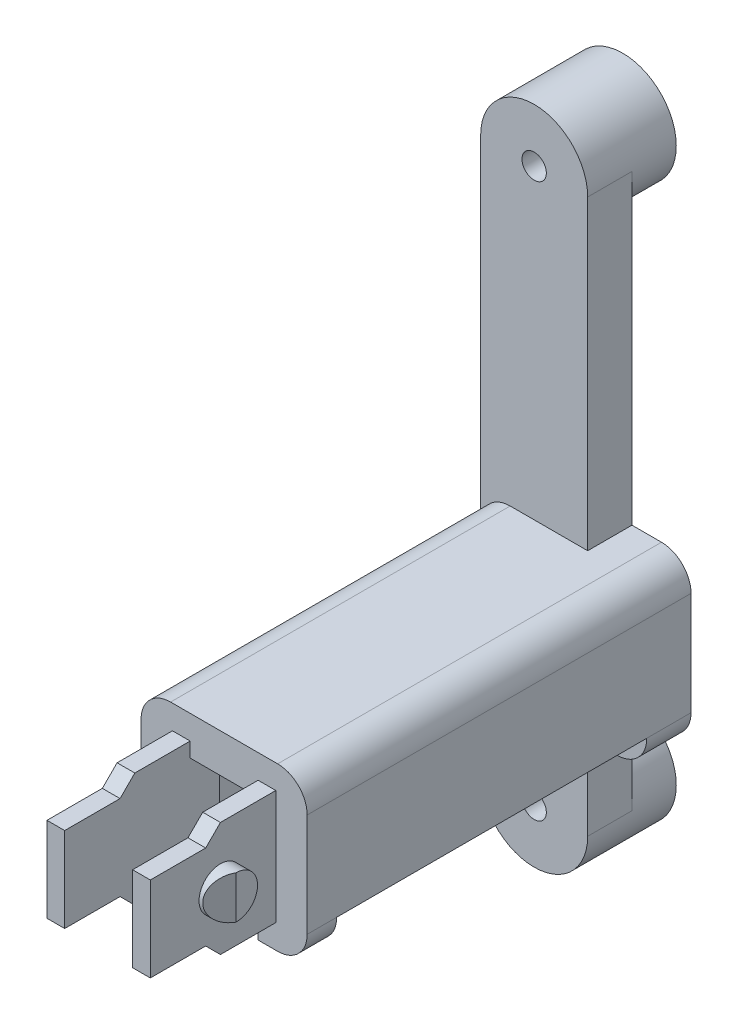
from build123d import *
from build123d.topology import SkipClean

# Parameters (mm, degrees)
SKETCH1_R           = 1.65
BOSS_EXTRUDE1_DEPTH = 75
SKETCH7_R           = 3
CUT_EXTRUDE6_DEPTH  = 6
CUT_EXTRUDE12_START = -63
CUT_EXTRUDE12_DEPTH = 63
SKETCH9_W           = 17
SKETCH9_H           = 22
SKETCH9_R           = 2.9
CUT_EXTRUDE8_DEPTH  = 4.25
CUT_EXTRUDE9_START  = -4.25
SKETCH10_W          = 17
SKETCH10_H          = 22
SKETCH10_R          = 2.9
CUT_EXTRUDE9_DEPTH  = 4.25
CUT_EXTRUDE10_DEPTH = 17
CUT_EXTRUDE11_START = -18.25
CUT_EXTRUDE11_DEPTH = 14
CUT_EXTRUDE13_START = -13.9000001
CUT_EXTRUDE13_DEPTH = 6.9000001
CUT_EXTRUDE14_DEPTH = 42


with BuildPart() as part:
    # Sketch1 → Boss-Extrude1 (new body)
    with BuildSketch(Plane.XY):
        with BuildLine():
            Line((15.25, 29.5), (15.25, 15.5))
            ThreePointArc((15.25, 15.5), (14.078427125, 12.671572875), (11.25, 11.5))
            Line((11.25, 11.5), (7.25, 11.5))
            Line((7.25, 11.5), (7.25, 0))
            ThreePointArc((7.25, 0), (0, -7.25), (-7.25, 0))
            Line((-7.25, 0), (-7.25, 75))
            ThreePointArc((-7.25, 75), (0, 82.25), (7.25, 75))
            Line((7.25, 75), (7.25, 33.5))
            Line((7.25, 33.5), (11.25, 33.5))
            ThreePointArc((11.25, 33.5), (14.078427125, 32.328427125), (15.25, 29.5))
        make_face()
        Circle(SKETCH1_R, mode=Mode.SUBTRACT)
        with Locations((0, 75)):
            Circle(SKETCH1_R, mode=Mode.SUBTRACT)
    extrude(amount=BOSS_EXTRUDE1_DEPTH)

    # Sketch7 → Cut-Extrude6 (cut)
    with SkipClean():  # the faces are left unmerged after this step: merging them gives an invalid solid
        with BuildSketch(Plane(origin=(0, 0, 0), x_dir=(-1, 0, 0), z_dir=(0, 0, -1))):
            with Locations((0, 75)):
                Circle(SKETCH7_R)
            Circle(SKETCH7_R)
            with BuildLine():
                Line((-7.25, 75), (-7.25, 33.5))
                Line((-7.25, 33.5), (-11.25, 33.5))
                ThreePointArc((-11.25, 33.5), (-14.078427125, 32.328427125), (-15.25, 29.5))
                Line((-15.25, 29.5), (-15.25, 15.5))
                ThreePointArc((-15.25, 15.5), (-14.078427125, 12.671572875), (-11.25, 11.5))
                Line((-11.25, 11.5), (-7.25, 11.5))
                Line((-7.25, 11.5), (-7.25, 0))
                ThreePointArc((-7.25, 0), (0, 7.25), (7.25, 0))
                Line((7.25, 0), (7.25, 75))
                ThreePointArc((7.25, 75), (0, 67.75), (-7.25, 75))
            make_face()
        extrude(amount=-CUT_EXTRUDE6_DEPTH, mode=Mode.SUBTRACT)

    # Sketch14 → Cut-Extrude12 (cut)
    with SkipClean():  # the faces are left unmerged after this step: merging them gives an invalid solid
        with BuildSketch(Plane.XY.offset(75).offset(CUT_EXTRUDE12_START)):
            with BuildLine():
                Line((-0.6, 28.25), (8.6, 28.25))
                Line((8.6, 28.25), (8.6, 11.5))
                Line((8.6, 11.5), (7.25, 11.5))
                Line((7.25, 11.5), (7.25, 0))
                ThreePointArc((7.25, 0), (0, -7.25), (-7.25, 0))
                Line((-7.25, 0), (-7.25, 15.5))
                ThreePointArc((-7.25, 15.5), (-6.078427125, 12.671572875), (-3.25, 11.5))
                Line((-3.25, 11.5), (-0.6, 11.5))
                Line((-0.6, 11.5), (-0.6, 28.25))
            make_face()
            with BuildLine():
                Line((7.25, 33.5), (-3.25, 33.5))
                ThreePointArc((-3.25, 33.5), (-6.078427125, 32.328427125), (-7.25, 29.5))
                Line((-7.25, 29.5), (-7.25, 75))
                ThreePointArc((-7.25, 75), (0, 82.25), (7.25, 75))
                Line((7.25, 75), (7.25, 33.5))
            make_face()
        extrude(amount=CUT_EXTRUDE12_DEPTH, mode=Mode.SUBTRACT)

    # Sketch9 → Cut-Extrude8 (cut)
    with SkipClean():  # the faces are left unmerged after this step: merging them gives an invalid solid
        with BuildSketch(Plane(origin=(15.25, 0, 0), x_dir=(0, 0, -1), z_dir=(1, 0, 0))):
            with Locations((-66.5, 22.5)):
                Rectangle(SKETCH9_W, SKETCH9_H)
            with Locations(Location((-65.5, 22.5, 0), (0, 0, 90))):
                Circle(SKETCH9_R, mode=Mode.SUBTRACT)
        extrude(amount=-CUT_EXTRUDE8_DEPTH, mode=Mode.SUBTRACT)

    # Sketch10 → Cut-Extrude9 (cut)
    with SkipClean():  # the faces are left unmerged after this step: merging them gives an invalid solid
        with BuildSketch(Plane.ZY.offset(7.25).offset(CUT_EXTRUDE9_START)):
            with Locations((66.5, 22.5)):
                Rectangle(SKETCH10_W, SKETCH10_H)
            with Locations(Location((65.5, 22.5, 0), (0, 0, 90))):
                Circle(SKETCH10_R, mode=Mode.SUBTRACT)
        extrude(amount=CUT_EXTRUDE9_DEPTH, mode=Mode.SUBTRACT)

    # Sketch11 → Cut-Extrude10 (cut)
    with SkipClean():  # the faces are left unmerged after this step: merging them gives an invalid solid
        with BuildSketch(Plane.XY.offset(75)):
            Polygon((-7.25, 14.75), (-7.25, 11.5), (15.25, 11.5), (15.25, 14.75), (8.6, 14.75), (8.6, 30.25), (15.25, 30.25), (15.25, 33.5), (-7.25, 33.5), (-7.25, 30.25), (-0.6, 30.25), (-0.6, 14.75), align=None)
        extrude(amount=-CUT_EXTRUDE10_DEPTH, mode=Mode.SUBTRACT)

    # Cut-Extrude11: read off the stored shape, not the designer's step
    # Cut-Extrude11 outline → Cut-Extrude11 (cut)
    with SkipClean():  # the faces are left unmerged after this step: merging them gives an invalid solid
        with BuildSketch(Plane.ZY.offset(7.25).offset(CUT_EXTRUDE11_START)):
            Polygon((75, 16.75), (67.5, 16.75), (65.5, 14.75), (75, 14.75), align=None)
            Polygon((67.5, 28.25), (75, 28.25), (75, 30.25), (65.5, 30.25), align=None)
        extrude(amount=CUT_EXTRUDE11_DEPTH, mode=Mode.SUBTRACT)

    # Cut-Extrude13: read off the stored shape, not the designer's step
    # Cut-Extrude13 outline → Cut-Extrude13 (cut)
    with SkipClean():  # the faces are left unmerged after this step: merging them gives an invalid solid
        with BuildSketch(Plane(origin=(0, 33.5, 0), x_dir=(1, 0, 0), z_dir=(0, 1, 0)).offset(CUT_EXTRUDE13_START)):
            Polygon((-3.5, -68.4), (-5.1, -65.5), (-5.125, -62.6), (-7.25, -62.6), (-7.25, -68.4), align=None)
            Polygon((13.125, -62.6), (13.1, -65.5), (11.5, -68.4), (15.25, -68.4), (15.25, -62.6), align=None)
        extrude(amount=CUT_EXTRUDE13_DEPTH, mode=Mode.SUBTRACT)

    # Sketch15 → Cut-Extrude14 (cut)
    with SkipClean():  # the faces are left unmerged after this step: merging them gives an invalid solid
        with BuildSketch(Plane.XY.offset(12)):
            with BuildLine():
                Line((-3.25, 11.5), (11.25, 11.5))
                ThreePointArc((11.25, 11.5), (14.078427125, 12.671572875), (15.25, 15.5))
                Line((15.25, 15.5), (13.25, 15.5))
                Line((13.25, 15.5), (13.25, 29.5))
                ThreePointArc((13.25, 29.5), (12.664213562, 30.914213562), (11.25, 31.5))
                Line((11.25, 31.5), (-3.25, 31.5))
                ThreePointArc((-3.25, 31.5), (-4.664213562, 30.914213562), (-5.25, 29.5))
                Line((-5.25, 29.5), (-5.25, 15.5))
                Line((-5.25, 15.5), (-7.25, 15.5))
                ThreePointArc((-7.25, 15.5), (-6.078427125, 12.671572875), (-3.25, 11.5))
            make_face()
        extrude(amount=CUT_EXTRUDE14_DEPTH, mode=Mode.SUBTRACT)


solid = part.part
